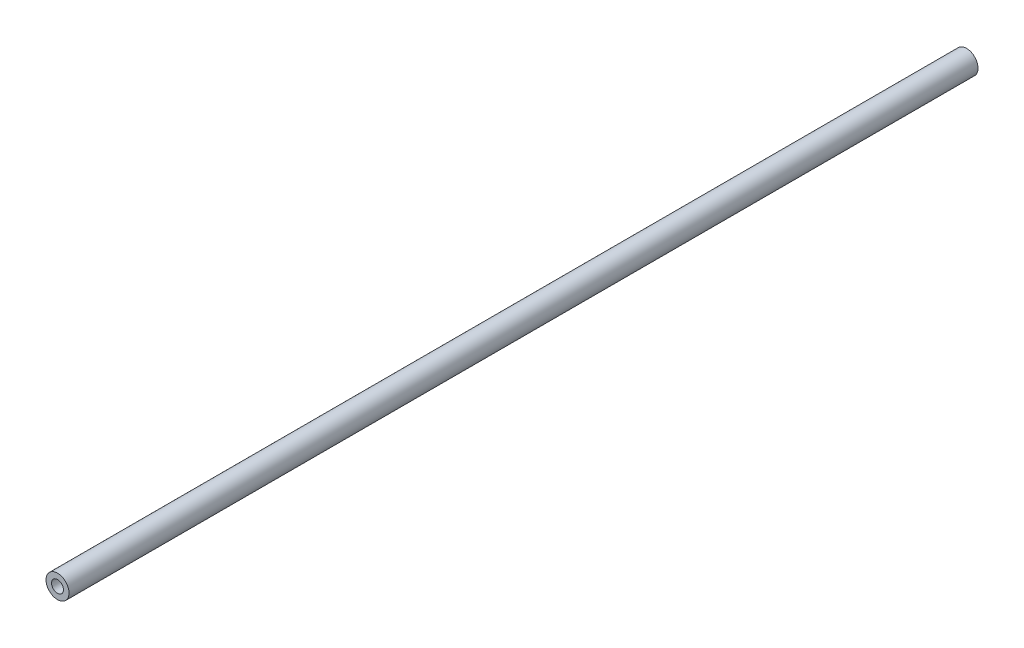
from build123d import *

# Parameters (mm, degrees)
SKETCH1_R                      = 5
BOSS_EXTRUDE1_DEPTH            = 395
F_6_0_204_DIAMETER_HOLE1_D     = 5.1816
F_6_0_204_DIAMETER_HOLE1_DEPTH = 30
F_6_0_204_DIAMETER_HOLE1_TIP   = 1.556709692
F_6_0_204_DIAMETER_HOLE2_D     = 5.1816
F_6_0_204_DIAMETER_HOLE2_DEPTH = 30
F_6_0_204_DIAMETER_HOLE2_TIP   = 1.556709692


with BuildPart() as part:
    # Sketch1 → Boss-Extrude1 (new body)
    with BuildSketch(Plane.XY):
        Circle(SKETCH1_R)
    extrude(amount=BOSS_EXTRUDE1_DEPTH)

    # #6 (0.204) Diameter Hole1
    with Locations(Plane(origin=(0, 0, 0), x_dir=(-1, 0, 0), z_dir=(0, 0, -1))):
        with Locations((0, 0)):
            Hole(F_6_0_204_DIAMETER_HOLE1_D / 2, depth=F_6_0_204_DIAMETER_HOLE1_DEPTH)
            with Locations((0, 0, -(F_6_0_204_DIAMETER_HOLE1_DEPTH + F_6_0_204_DIAMETER_HOLE1_TIP / 2))):  # 118° drill point
                Cone(0, F_6_0_204_DIAMETER_HOLE1_D / 2, F_6_0_204_DIAMETER_HOLE1_TIP, mode=Mode.SUBTRACT)

    # #6 (0.204) Diameter Hole2
    with Locations(Plane.XY.offset(395)):
        with Locations((0, 0)):
            Hole(F_6_0_204_DIAMETER_HOLE2_D / 2, depth=F_6_0_204_DIAMETER_HOLE2_DEPTH)
            with Locations((0, 0, -(F_6_0_204_DIAMETER_HOLE2_DEPTH + F_6_0_204_DIAMETER_HOLE2_TIP / 2))):  # 118° drill point
                Cone(0, F_6_0_204_DIAMETER_HOLE2_D / 2, F_6_0_204_DIAMETER_HOLE2_TIP, mode=Mode.SUBTRACT)


solid = part.part
